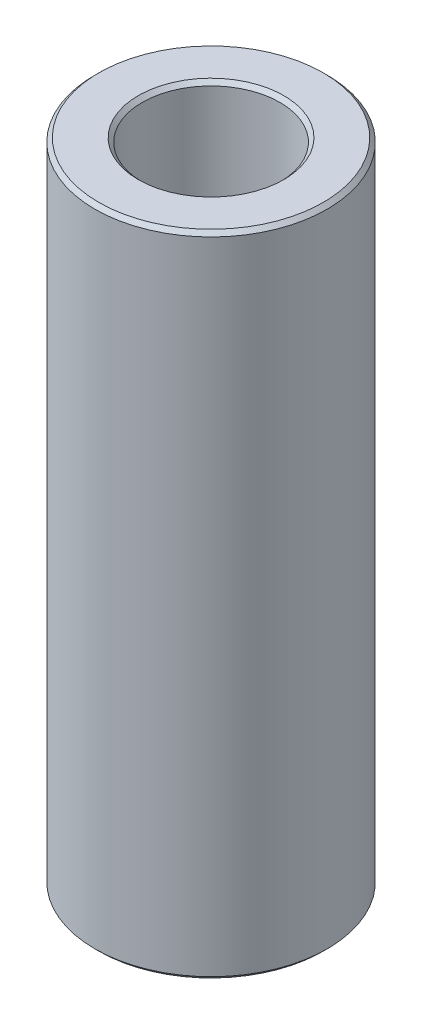
from build123d import *

# Parameters (mm, degrees)
SKETCH1_R           = 52.5
BOSS_EXTRUDE1_DEPTH = 293.05801973
SKETCH2_R           = 31.128654892
CUT_EXTRUDE1_DEPTH  = 303.316891569
CHAMFER1_SIZE       = 1.77300052


with BuildPart() as part:
    # Sketch1 → Boss-Extrude1 (new body)
    with BuildSketch(Plane(origin=(0, 0, 0), x_dir=(1, 0, 0), z_dir=(0, 1, 0))):
        Circle(SKETCH1_R)
    extrude(amount=BOSS_EXTRUDE1_DEPTH)

    # Sketch2 → Cut-Extrude1 (cut, through all)
    with BuildSketch(Plane(origin=(0, 0, 0), x_dir=(1, 0, 0), z_dir=(0, 1, 0))):
        Circle(SKETCH2_R)
    extrude(amount=CUT_EXTRUDE1_DEPTH, mode=Mode.SUBTRACT)

    # Chamfer1
    chamfer1_edges = [part.edges().sort_by_distance(p)[0] for p in [
        (-31.128654892, 293.05801973, 0),
        (-31.128654892, 0, 0),
        (-52.5, 0, 0),
        (-52.5, 293.05801973, 0),
    ]]
    chamfer(chamfer1_edges, length=CHAMFER1_SIZE)


solid = part.part
